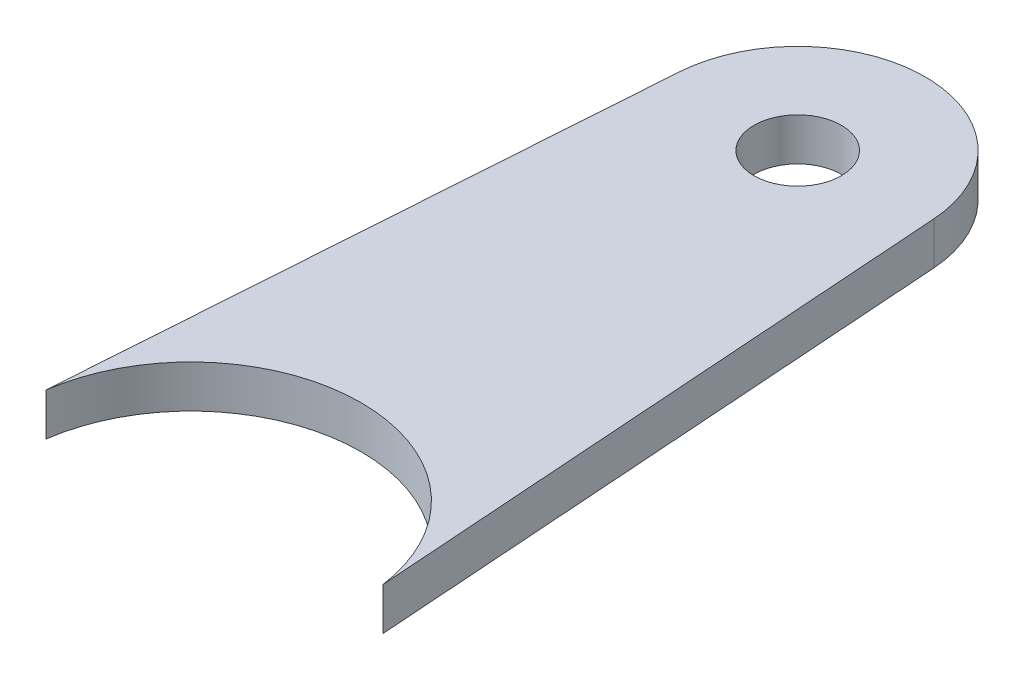
from build123d import *

# Parameters (mm, degrees)
SKETCH1_R           = 3.2639
BOSS_EXTRUDE1_DEPTH = 3.175


with BuildPart() as part:
    # Sketch1 → Boss-Extrude1 (new body)
    with BuildSketch(Plane(origin=(0, 0, 0), x_dir=(1, 0, 0), z_dir=(0, 1, 0))):
        with BuildLine():
            Line((3.197970198, 45.964541088), (0.122360007, 1.758684792))
            ThreePointArc((0.122360007, 1.758684792), (12.7, 12.7), (25.277639993, 1.758684792))
            Line((25.277639993, 1.758684792), (22.202029802, 45.964541088))
            ThreePointArc((22.202029802, 45.964541088), (12.7, 54.82844), (3.197970198, 45.964541088))
        make_face()
        with Locations((12.7, 45.30344)):
            Circle(SKETCH1_R, mode=Mode.SUBTRACT)
    extrude(amount=BOSS_EXTRUDE1_DEPTH)


solid = part.part
